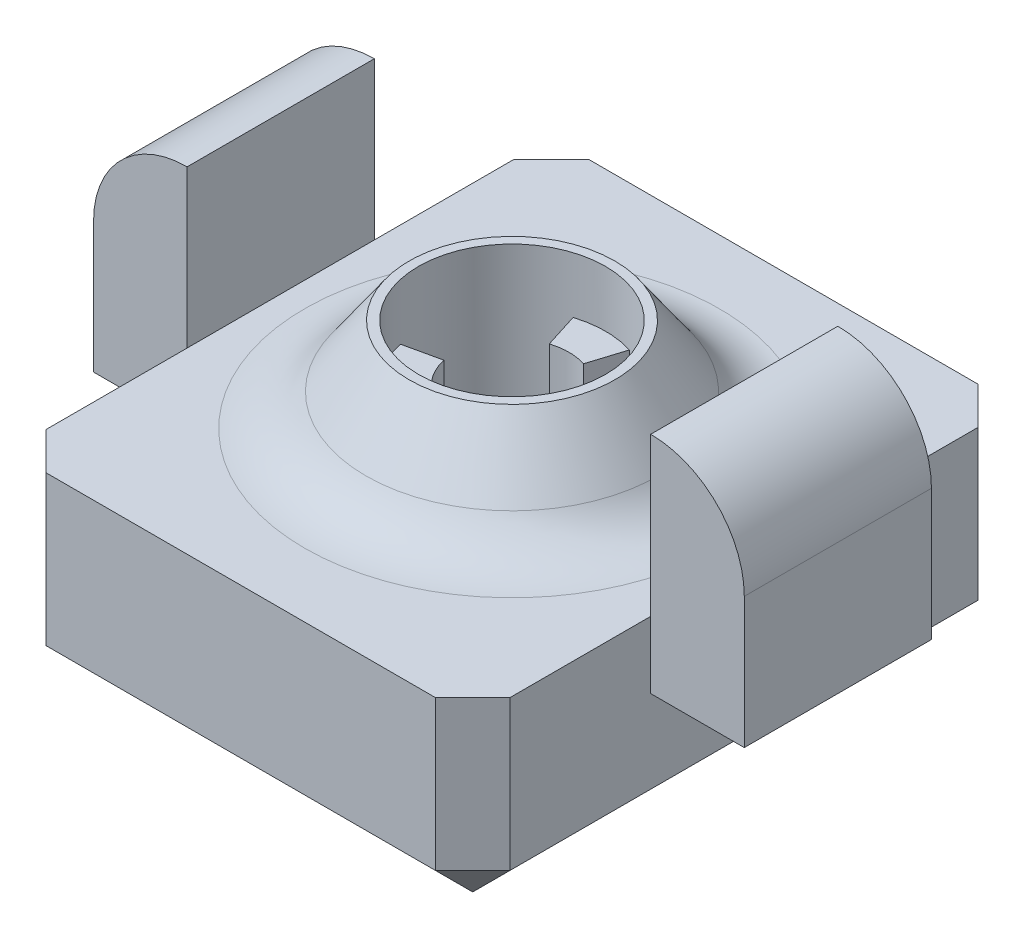
from build123d import *

# Parameters (mm, degrees)
SKETCH1_W           = 24.8
SKETCH1_H           = 29
BOSS_EXTRUDE1_DEPTH = 5
SKETCH2_R           = 9
BOSS_EXTRUDE2_DEPTH = 5.8
BOSS_EXTRUDE2_TAPER = 35
SKETCH4_R           = 5
CUT_EXTRUDE2_DEPTH  = 25.771959955
BOSS_EXTRUDE3_DEPTH = 12
CHAMFER1_SIZE       = 2
FILLET2_R           = 4
SKETCH6_W           = 30
SKETCH6_H           = 2
CUT_EXTRUDE3_DEPTH  = 34.309452563
SKETCH7_W           = 10
SKETCH7_H           = 12
BOSS_EXTRUDE4_DEPTH = 5
SKETCH9_W           = 10
SKETCH9_H           = 12
BOSS_EXTRUDE5_DEPTH = 5
FILLET3_R           = 5


with BuildPart() as part:
    # Sketch1 → Boss-Extrude1 (new, symmetric)
    with BuildSketch(Plane(origin=(0, 0, 0), x_dir=(1, 0, 0), z_dir=(0, 1, 0))):
        Rectangle(SKETCH1_W, SKETCH1_H)
    extrude(amount=BOSS_EXTRUDE1_DEPTH, both=True)

    # Sketch2 → Boss-Extrude2 (add)
    with BuildSketch(Plane(origin=(0, 5, 0), x_dir=(1, 0, 0), z_dir=(0, 1, 0))):
        Circle(SKETCH2_R)
    extrude(amount=BOSS_EXTRUDE2_DEPTH, taper=BOSS_EXTRUDE2_TAPER)

    # Sketch4 → Cut-Extrude2 (cut, through all)
    with BuildSketch(Plane(origin=(0, 10.8, 0), x_dir=(1, 0, 0), z_dir=(0, 1, 0))):
        with Locations(Location((0, 0, 0), (0, 0, 270))):
            Circle(SKETCH4_R)
    extrude(amount=-CUT_EXTRUDE2_DEPTH, mode=Mode.SUBTRACT)

    # Sketch5 → Boss-Extrude3 (add)
    with BuildSketch(Plane(origin=(0, -5, 0), x_dir=(1, 0, 0), z_dir=(0, 1, 0))):
        with BuildLine():
            Line((-1.533599577, 4.863956449), (-0.917152688, 2.9088367))
            ThreePointArc((-0.917152688, 2.9088367), (0, 3.05), (0.917152688, 2.9088367))
            Line((0.917152688, 2.9088367), (1.533599577, 4.863956449))
            ThreePointArc((1.533599577, 4.863956449), (0, 5.1), (-1.533599577, 4.863956449))
        make_face()
        with BuildLine():
            Line((3.445510059, -3.760114418), (2.060550133, -2.248695877))
            ThreePointArc((2.060550133, -2.248695877), (2.641377482, -1.525), (2.977702822, -0.660140823))
            Line((2.977702822, -0.660140823), (4.979109636, -1.103842031))
            ThreePointArc((4.979109636, -1.103842031), (4.416729559, -2.55), (3.445510059, -3.760114418))
        make_face()
        with BuildLine():
            Line((-4.979109636, -1.103842031), (-2.977702822, -0.660140823))
            ThreePointArc((-2.977702822, -0.660140823), (-2.641377482, -1.525), (-2.060550133, -2.248695877))
            Line((-2.060550133, -2.248695877), (-3.445510059, -3.760114418))
            ThreePointArc((-3.445510059, -3.760114418), (-4.416729559, -2.55), (-4.979109636, -1.103842031))
        make_face()
    extrude(amount=BOSS_EXTRUDE3_DEPTH)

    # Chamfer1
    chamfer1_edges = [part.edges().sort_by_distance(p)[0] for p in [
        (0, -5, 14.5),
        (-12.4, -5, 0),
        (0, -5, -14.5),
        (12.4, -5, 0),
        (12.4, 0, 14.5),
        (-12.4, 0, 14.5),
        (-12.4, 0, -14.5),
        (12.4, 0, -14.5),
    ]]
    chamfer(chamfer1_edges, length=CHAMFER1_SIZE)

    # Fillet2
    fillet2_edges = [part.edges().sort_by_distance(p)[0] for p in [
        (-9, 5, 0),
    ]]
    fillet(fillet2_edges, radius=FILLET2_R)

    # Sketch6 → Cut-Extrude3 (cut, through all)
    with BuildSketch(Plane.XY.offset(14.5)):
        with Locations((0, 11)):
            Rectangle(SKETCH6_W, SKETCH6_H)
    extrude(amount=-CUT_EXTRUDE3_DEPTH, mode=Mode.SUBTRACT)

    # Sketch7 → Boss-Extrude4 (add)
    with BuildSketch(Plane.ZY.offset(12.4)):
        with Locations((-0.042035607, 7.386997459)):
            Rectangle(SKETCH7_W, SKETCH7_H)
    extrude(amount=BOSS_EXTRUDE4_DEPTH)

    # Sketch9 → Boss-Extrude5 (add)
    with BuildSketch(Plane(origin=(12.4, 0, 0), x_dir=(0, 0, -1), z_dir=(1, 0, 0))):
        with Locations((0.01160307, 7.425228999)):
            Rectangle(SKETCH9_W, SKETCH9_H)
    extrude(amount=BOSS_EXTRUDE5_DEPTH)

    # Fillet3
    fillet3_edges = [part.edges().sort_by_distance(p)[0] for p in [
        (17.4, 13.425228999, -0.01160307),
        (-17.4, 13.386997459, -0.042035607),
    ]]
    fillet(fillet3_edges, radius=FILLET3_R - 0.0001)  # a hair under: the kernel refuses the full size


solid = part.part
